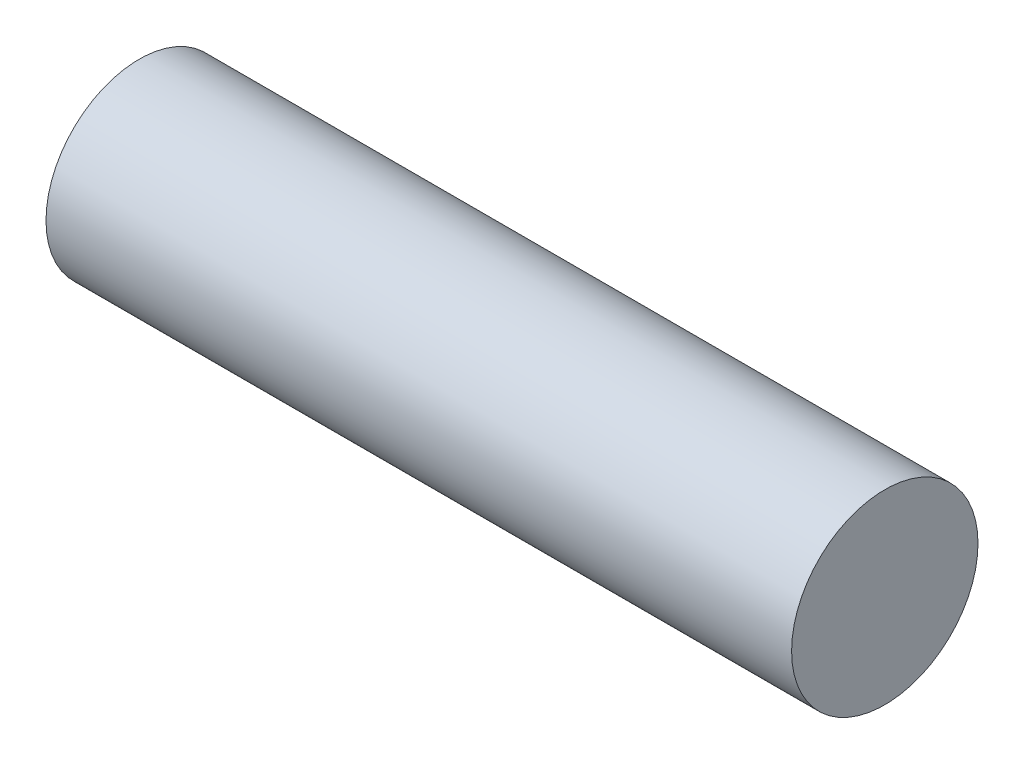
from build123d import *

# Parameters (mm, degrees)
BOSS_EXTRUDE1_DEPTH      = 4
BOSS_EXTRUDE1_DEPTH_BACK = 4
SKETCH1_R                = 1


with BuildPart() as part:
    # Sketch1 → Boss-Extrude1 (new, two sides: drawn at the far end of the back side and taken through both)
    with BuildSketch(Plane(origin=(0, 0, 0), x_dir=(0, 0, -1), z_dir=(1, 0, 0)).offset(-BOSS_EXTRUDE1_DEPTH_BACK)):
        Circle(SKETCH1_R)
    extrude(amount=BOSS_EXTRUDE1_DEPTH + BOSS_EXTRUDE1_DEPTH_BACK)


solid = part.part
